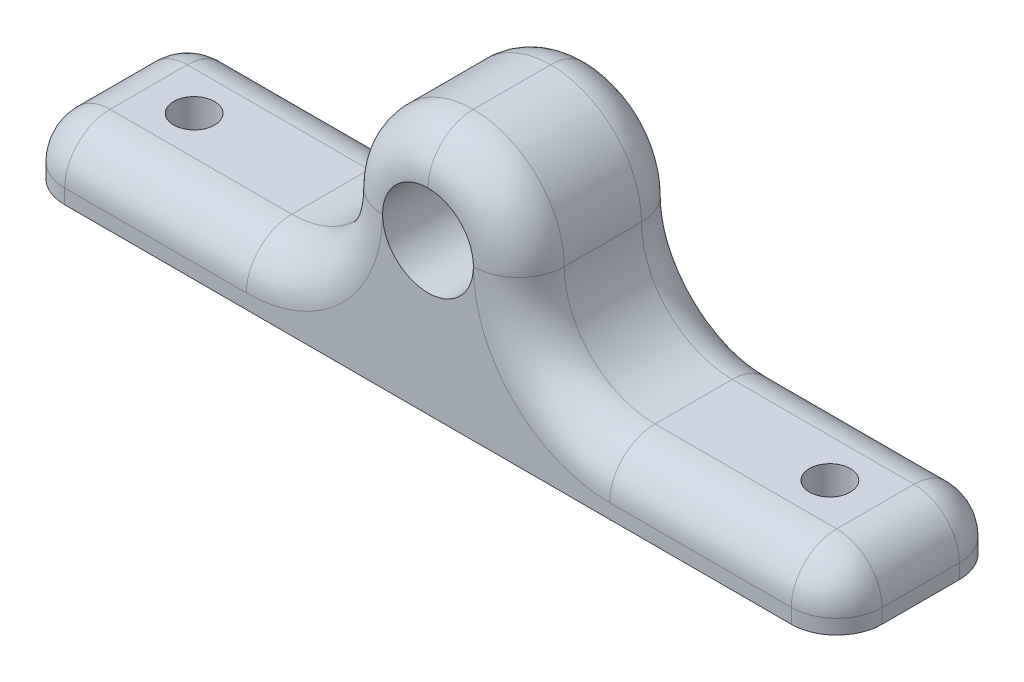
from build123d import *

# Parameters (mm, degrees)
SKETCH1_R            = 5
BOSS_EXTRUDE1_DEPTH  = 18.5
FILLET1_DEPTH        = 18.5
FILLET1_2_DEPTH      = 18.5
M4_CLEARANCE_HOLE1_D = 4.5
FILLET3_R            = 5
FILLET2_R            = 5


with BuildPart() as part:
    # Sketch1 → Boss-Extrude1 (new body)
    with BuildSketch(Plane.XY):
        Polygon((10, -10), (45, -10), (45, -16.6), (-45, -16.6), (-45, -10), (-10, -10), (-10, 10), (10, 10), align=None)
        Circle(SKETCH1_R, mode=Mode.SUBTRACT)
    extrude(amount=BOSS_EXTRUDE1_DEPTH)

    # Fillet1: read off the stored shape, not the designer's step
    # Fillet1 outline → Fillet1 (cut)
    with BuildSketch(Plane.XY):
        with BuildLine():
            Line((10, 10), (0, 10))
            ThreePointArc((0, 10), (7.071067812, 7.071067812), (10, 0))
            Line((10, 0), (10, 10))
        make_face()
        with BuildLine():
            Line((-10, 10), (-10, 0))
            ThreePointArc((-10, 0), (-7.071067812, 7.071067812), (0, 10))
            Line((0, 10), (-10, 10))
        make_face()
    extrude(amount=FILLET1_DEPTH, mode=Mode.SUBTRACT)

    # Fillet1 2 outline → Fillet1 2 (add)
    with BuildSketch(Plane.XY):
        with BuildLine():
            ThreePointArc((20, -10), (12.928932188, -7.071067812), (10, 0))
            Line((10, 0), (10, -10))
            Line((10, -10), (20, -10))
        make_face()
        with BuildLine():
            ThreePointArc((-10, 0), (-12.928932188, -7.071067812), (-20, -10))
            Line((-20, -10), (-10, -10))
            Line((-10, -10), (-10, 0))
        make_face()
    extrude(amount=FILLET1_2_DEPTH)

    # M4 Clearance Hole1 (through all)
    with Locations(Plane(origin=(0, -10, 0), x_dir=(1, 0, 0), z_dir=(0, 1, 0))):
        with Locations((-35, -9.25), (35, -9.25)):
            Hole(M4_CLEARANCE_HOLE1_D / 2)

    # Fillet3
    fillet3_edges = [part.edges().sort_by_distance(p)[0] for p in [
        (-45, -13.3, 0),
        (-45, -13.3, 18.5),
        (45, -13.3, 18.5),
        (45, -13.3, 0),
    ]]
    fillet(fillet3_edges, radius=FILLET3_R)

    # Fillet2
    fillet2_edges = [part.edges().sort_by_distance(p)[0] for p in [
        (-30, -10, 0),
        (-30, -10, 18.5),
        (-7.071067812, 7.071067812, 0),
        (7.071067812, 7.071067812, 0),
        (-7.071067812, 7.071067812, 18.5),
        (7.071067812, 7.071067812, 18.5),
        (12.928932188, -7.071067812, 0),
        (12.928932188, -7.071067812, 18.5),
        (-12.928932188, -7.071067812, 0),
        (-12.928932188, -7.071067812, 18.5),
        (30, -10, 18.5),
        (-45, -10, 9.25),
        (-43.535533906, -10, 1.464466094),
        (-43.535533906, -10, 17.035533906),
        (30, -10, 0),
        (45, -10, 9.25),
        (43.535533906, -10, 1.464466094),
        (43.535533906, -10, 17.035533906),
    ]]
    fillet(fillet2_edges, radius=FILLET2_R - 0.0001)  # a hair under: the kernel refuses the full size


solid = part.part
